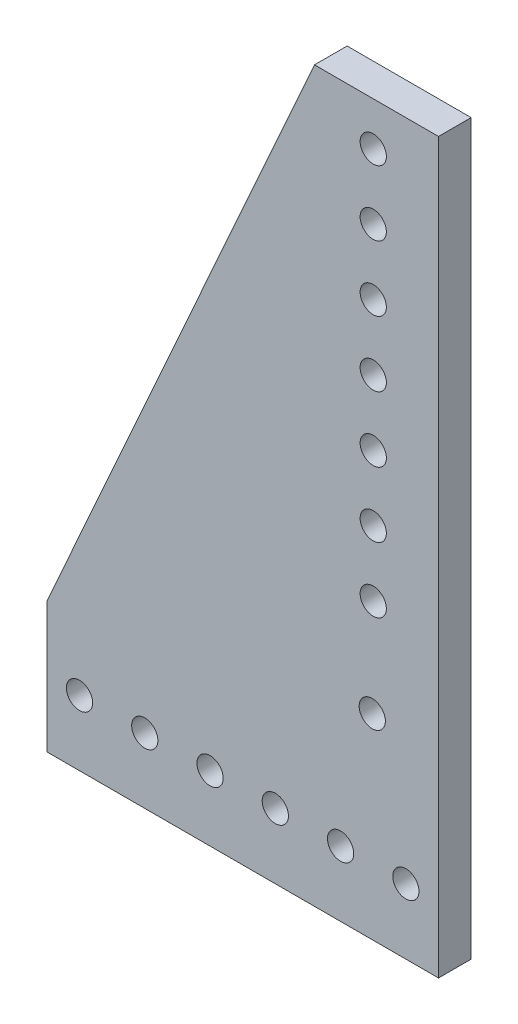
from build123d import *

# Parameters (mm, degrees)
SKETCH1_W           = 177.8
SKETCH1_H           = 254
BOSS_EXTRUDE1_DEPTH = 6.35
SKETCH2_R           = 2.5527
CUT_EXTRUDE1_DEPTH  = 189.819402987
SKETCH3_R           = 2.5527
CUT_EXTRUDE2_DEPTH  = 189.819402987
CUT_EXTRUDE3_DEPTH  = 189.819402987


with BuildPart() as part:
    # Sketch1 → Boss-Extrude1 (new body)
    with BuildSketch(Plane.XY):
        with Locations((-39.1, 11.666666667)):
            Rectangle(SKETCH1_W, SKETCH1_H)
    extrude(amount=BOSS_EXTRUDE1_DEPTH)

    # Sketch2 → Cut-Extrude1 (cut, through all)
    with BuildSketch(Plane.XY.offset(6.35)):
        with Locations((-39.1, -58.183333333)):
            Circle(SKETCH2_R)
        with Locations((-39.1, -45.483333333)):
            Circle(SKETCH2_R)
        with Locations((-39.1, -32.783333333)):
            Circle(SKETCH2_R)
        with Locations((-39.1, -20.083333333)):
            Circle(SKETCH2_R)
        with Locations((-39.1, -7.383333333)):
            Circle(SKETCH2_R)
        with Locations((-39.1, 5.316666667)):
            Circle(SKETCH2_R)
        with Locations((-39.1, 18.016666667)):
            Circle(SKETCH2_R)
        with Locations((-39.1, 30.716666667)):
            Circle(SKETCH2_R)
        with Locations((-39.2905, -77.233333333)):
            Circle(SKETCH2_R)
    extrude(amount=-CUT_EXTRUDE1_DEPTH, mode=Mode.SUBTRACT)

    # Sketch3 → Cut-Extrude2 (cut, through all)
    with BuildSketch(Plane.XY.offset(6.35)):
        with Locations((30.75, -102.633333333)):
            Circle(SKETCH3_R)
        with Locations((18.05, -102.633333333)):
            Circle(SKETCH3_R)
        with Locations((5.35, -102.633333333)):
            Circle(SKETCH3_R)
        with Locations((-7.35, -102.633333333)):
            Circle(SKETCH3_R)
        with Locations((-20.05, -102.633333333)):
            Circle(SKETCH3_R)
        with Locations((-32.75, -102.633333333)):
            Circle(SKETCH3_R)
        with Locations((-45.45, -102.633333333)):
            Circle(SKETCH3_R)
        with Locations((-58.15, -102.633333333)):
            Circle(SKETCH3_R)
        with Locations((-70.85, -102.633333333)):
            Circle(SKETCH3_R)
        with Locations((-83.55, -102.633333333)):
            Circle(SKETCH3_R)
        with Locations((-96.25, -102.633333333)):
            Circle(SKETCH3_R)
        with Locations((-108.95, -102.633333333)):
            Circle(SKETCH3_R)
    extrude(amount=-CUT_EXTRUDE2_DEPTH, mode=Mode.SUBTRACT)

    # Sketch4 → Cut-Extrude3 (cut, through all)
    with BuildSketch(Plane.XY.offset(6.35)):
        Polygon((-128, -115.333333333), (-102.6, -115.333333333), (-102.6, -89.933333333), (-50.53, 26.464089319), (-26.4, 26.464089319), (-26.4, -89.933333333), (-26.4, -115.333333333), (49.8, -115.333333333), (49.8, 138.666666667), (-128, 138.666666667), align=None)
    extrude(amount=-CUT_EXTRUDE3_DEPTH, mode=Mode.SUBTRACT)


solid = part.part
